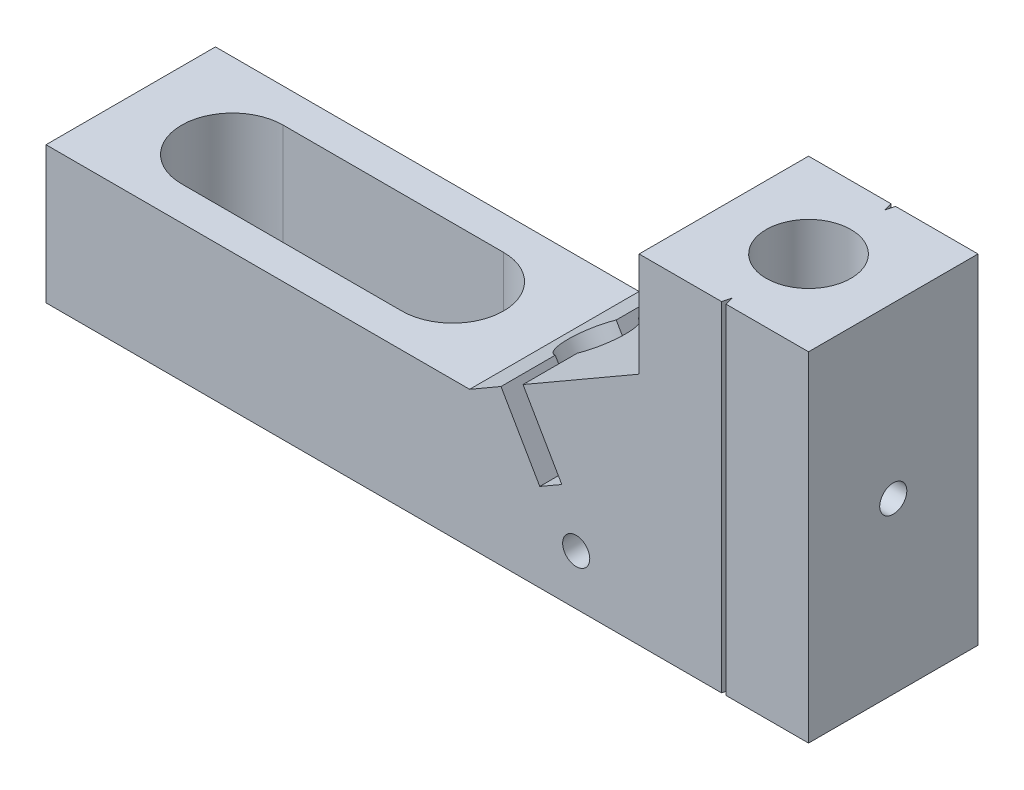
from build123d import *

# Parameters (mm, degrees)
SKETCH1_W                 = 20
SKETCH1_H                 = 10
BOSS_EXTRUDE1_DEPTH       = 20
SKETCH2_R                 = 2.5
CUT_EXTRUDE1_DEPTH        = 26.836409614
CUT_EXTRUDE2_DEPTH        = 27.191969955
SKETCH5_R                 = 1.95
CUT_EXTRUDE5_DEPTH        = 21.021203074
M2X0_4_TAPPED_HOLE1_D     = 1.6
M2X0_4_TAPPED_HOLE1_DEPTH = 6
M2X0_4_TAPPED_HOLE1_TIP   = 0.480688495
M2X0_4_TAPPED_HOLE2_D     = 1.6
M2X0_4_TAPPED_HOLE2_DEPTH = 6
M2X0_4_TAPPED_HOLE2_TIP   = 0.480688495
SKETCH14_W                = 10
SKETCH14_H                = 8.082903769
BOSS_EXTRUDE3_DEPTH       = 25
CUT_EXTRUDE7_REACH        = 43.43


with BuildPart() as part:
    # Sketch1 → Boss-Extrude1 (new body)
    with BuildSketch(Plane(origin=(0, 0, 0), x_dir=(1, 0, 0), z_dir=(0, 1, 0))):
        with Locations((-3.638888889, 4.027777778)):
            Rectangle(SKETCH1_W, SKETCH1_H)
    extrude(amount=BOSS_EXTRUDE1_DEPTH)

    # Sketch2 → Cut-Extrude1 (cut, through all)
    with BuildSketch(Plane(origin=(0, 20, 0), x_dir=(1, 0, 0), z_dir=(0, 1, 0))):
        with Locations((1.361111111, 4.027777778)):
            Circle(SKETCH2_R)
        Polygon((1.495085707, -0.972222222), (1.361111111, -0.472222222), (1.227136515, -0.972222222), align=None)
        Polygon((1.361111111, 8.527777778), (1.227136515, 9.027777778), (1.495085707, 9.027777778), align=None)
    extrude(amount=-CUT_EXTRUDE1_DEPTH, mode=Mode.SUBTRACT)

    # Sketch3 → Cut-Extrude2 (cut, through all)
    with BuildSketch(Plane.XY.offset(0.972222222)):
        Polygon((-13.638888889, 20), (-3.638888889, 20), (-3.638888889, 13.856406461), (-10.489369836, 9.901279442), (-8.200869836, 5.937481169), (-9.499907942, 5.187481169), (-11.788407942, 9.151279442), (-13.638888889, 8.082903769), align=None)
    extrude(amount=-CUT_EXTRUDE2_DEPTH, mode=Mode.SUBTRACT)

    # Sketch5 → Cut-Extrude5 (cut, through all)
    with BuildSketch(Plane(origin=(-6.909722222, 11.967989955, 0), x_dir=(0.8660254037844415, 0.49999999999999534, 0), z_dir=(-0.49999999999999534, 0.8660254037844415, 0))):
        with Locations((-4.883421027, 4.027777778)):
            Circle(SKETCH5_R)
    extrude(amount=-CUT_EXTRUDE5_DEPTH, mode=Mode.SUBTRACT)

    # M2x0.4 Tapped Hole1
    with Locations(Plane(origin=(6.361111111, 0, 0), x_dir=(0, 0, -1), z_dir=(1, 0, 0))):
        with Locations((4.027777778, 10)):
            Hole(M2X0_4_TAPPED_HOLE1_D / 2, depth=M2X0_4_TAPPED_HOLE1_DEPTH)
            with Locations((0, 0, -(M2X0_4_TAPPED_HOLE1_DEPTH + M2X0_4_TAPPED_HOLE1_TIP / 2))):  # 118° drill point
                Cone(0, M2X0_4_TAPPED_HOLE1_D / 2, M2X0_4_TAPPED_HOLE1_TIP, mode=Mode.SUBTRACT)

    # M2x0.4 Tapped Hole2
    with Locations(Plane.XY.offset(0.972222222)):
        with Locations((-7.350388889, 2.964404957)):
            Hole(M2X0_4_TAPPED_HOLE2_D / 2, depth=M2X0_4_TAPPED_HOLE2_DEPTH)
            with Locations((0, 0, -(M2X0_4_TAPPED_HOLE2_DEPTH + M2X0_4_TAPPED_HOLE2_TIP / 2))):  # 118° drill point
                Cone(0, M2X0_4_TAPPED_HOLE2_D / 2, M2X0_4_TAPPED_HOLE2_TIP, mode=Mode.SUBTRACT)

    # Sketch14 → Boss-Extrude3 (add)
    with BuildSketch(Plane.ZY.offset(13.638888889)):
        with Locations((-4.027777778, 4.041451884)):
            Rectangle(SKETCH14_W, SKETCH14_H)
    extrude(amount=BOSS_EXTRUDE3_DEPTH)

    # Sketch15 → Cut-Extrude7 (cut, up to next)
    with BuildSketch(Plane(origin=(0, 8.082903769, 0), x_dir=(1, 0, 0), z_dir=(0, 1, 0)), mode=Mode.PRIVATE) as cut_extrude7_sk1:
        with BuildLine():
            Line((-19.638888889, 1.027777778), (-32.638888889, 1.027777778))
            ThreePointArc((-32.638888889, 1.027777778), (-35.638888889, 4.027777778), (-32.638888889, 7.027777778))
            Line((-32.638888889, 7.027777778), (-19.638888889, 7.027777778))
            ThreePointArc((-19.638888889, 7.027777778), (-16.638888889, 4.027777778), (-19.638888889, 1.027777778))
        make_face()
    cut_extrude7_tool1 = extrude(cut_extrude7_sk1.sketch, amount=-CUT_EXTRUDE7_REACH, mode=Mode.PRIVATE) & part.part
    add(cut_extrude7_tool1.solids().sort_by_distance((-26.138889, 8.082904, -4.027778))[0], mode=Mode.SUBTRACT)


solid = part.part
